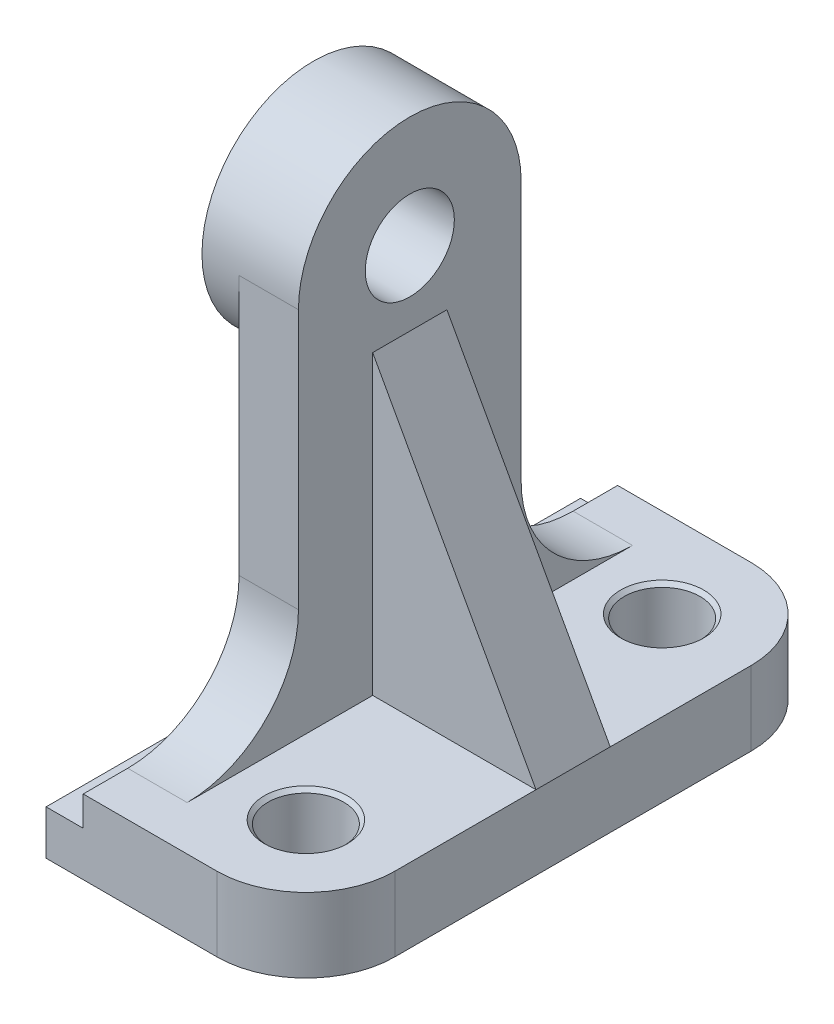
from build123d import *
from build123d.topology import SkipClean

# Parameters (mm, degrees)
BOSS_EXTRUDE3_DEPTH = 5
BOSS_EXTRUDE4_DEPTH = 36
SKETCH5_R           = 6
BOSS_EXTRUDE5_DEPTH = 8
SKETCH6_R           = 15
SKETCH6_R_2         = 6
BOSS_EXTRUDE6_DEPTH = 5
FILLET1_R           = 12
SKETCH8_R           = 5.1
CUT_EXTRUDE1_DEPTH  = 78.491935064
CHAMFER1_SIZE       = 0.5


with BuildPart() as part:
    # Sketch3 → Boss-Extrude3 (new, symmetric)
    with BuildSketch(Plane.XY):
        Polygon((0, 0), (0, 40), (22, 0), align=None)
    extrude(amount=BOSS_EXTRUDE3_DEPTH, both=True)

    # Sketch4 → Boss-Extrude4 (add, symmetric)
    with BuildSketch(Plane.XY):
        Polygon((22, 0), (-8, 0), (-8, -4), (-13, -4), (-13, -10), (22, -10), align=None)
    extrude(amount=BOSS_EXTRUDE4_DEPTH, both=True)

    # Sketch5 → Boss-Extrude5 (add)
    with BuildSketch(Plane(origin=(0, 0, 0), x_dir=(0, 0, -1), z_dir=(1, 0, 0))):
        with BuildLine():
            Line((-30, 0), (30, 0))
            ThreePointArc((30, 0), (19.393398282, 4.393398282), (15, 15))
            Line((15, 15), (15, 50))
            ThreePointArc((15, 50), (0, 65), (-15, 50))
            Line((-15, 50), (-15, 15))
            ThreePointArc((-15, 15), (-19.393398282, 4.393398282), (-30, 0))
        make_face()
        with Locations((0, 50)):
            Circle(SKETCH5_R, mode=Mode.SUBTRACT)
    extrude(amount=-BOSS_EXTRUDE5_DEPTH)

    # Sketch6 → Boss-Extrude6 (add)
    with SkipClean():  # the faces are left unmerged after this step: merging them gives an invalid solid
        with BuildSketch(Plane.ZY.offset(8)):
            with Locations((0, 50)):
                Circle(SKETCH6_R)
            with Locations((0, 50)):
                Circle(SKETCH6_R_2, mode=Mode.SUBTRACT)
        extrude(amount=BOSS_EXTRUDE6_DEPTH)
    add(part.part.scale(1), mode=Mode.REPLACE)  # the faces are merged on a copy

    # Fillet1
    fillet1_edges = [part.edges().sort_by_distance(p)[0] for p in [
        (22, -5, 36),
        (22, -5, -36),
    ]]
    fillet(fillet1_edges, radius=FILLET1_R)

    # Sketch8 → Cut-Extrude1 (cut, through all)
    with SkipClean():  # the faces are left unmerged after this step: merging them gives an invalid solid
        with BuildSketch(Plane(origin=(0, 0, 0), x_dir=(1, 0, 0), z_dir=(0, 1, 0))):
            with Locations((10, 24)):
                Circle(SKETCH8_R)
            with Locations((10, -24)):
                Circle(SKETCH8_R)
        extrude(amount=-CUT_EXTRUDE1_DEPTH, mode=Mode.SUBTRACT)

    # Chamfer1
    chamfer1_edges = [part.edges().sort_by_distance(p)[0] for p in [
        (4.9, 0, -24),
        (4.9, 0, 24),
    ]]
    chamfer(chamfer1_edges, length=CHAMFER1_SIZE)


solid = part.part
